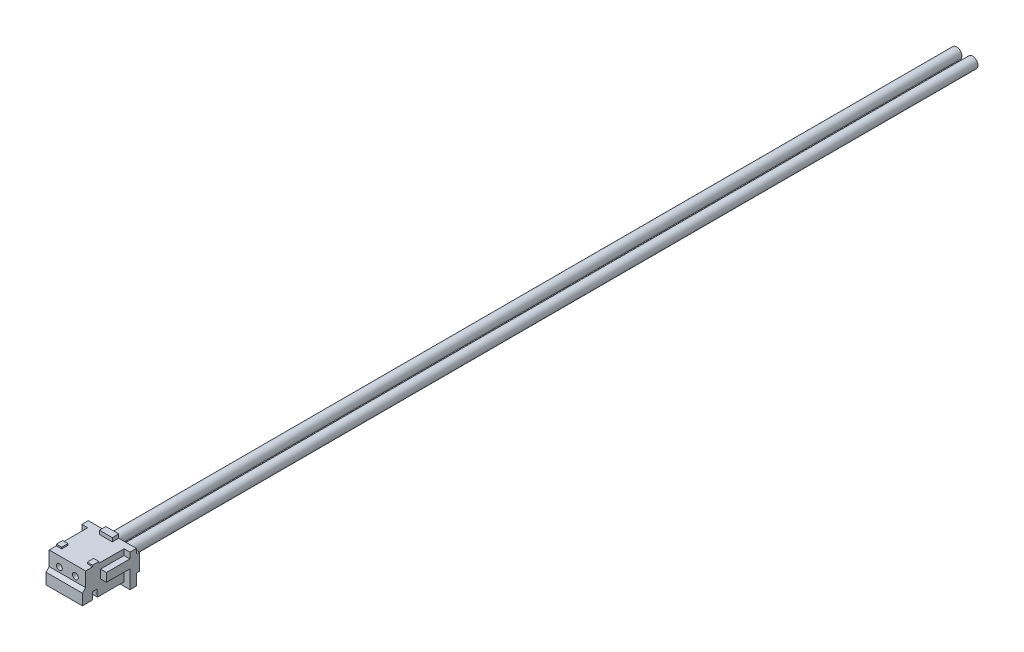
from build123d import *

# Parameters (mm, degrees)
SKETCH1_W                        = 4.5
SKETCH1_H                        = 3.05
BOSS_EXTRUDE1_DEPTH              = 0.6
SKETCH2_W                        = 0.94
SKETCH2_H                        = 1.55
BOSS_EXTRUDE2_DEPTH              = 0.3
SKETCH3_W                        = 0.94
SKETCH3_H                        = 1.55
BOSS_EXTRUDE3_DEPTH              = 0.3
SKETCH4_W                        = 2.62
SKETCH4_H                        = 1.55
CUT_EXTRUDE1_DEPTH               = 0.3
SKETCH5_W                        = 3.4
SKETCH5_H                        = 2.68
BOSS_EXTRUDE4_DEPTH              = 3.9
SKETCH6_W                        = 2.2
SKETCH6_H                        = 0.8
BOSS_EXTRUDE5_DEPTH              = 0.55
SKETCH7_W                        = 2.2
SKETCH7_H                        = 0.8
BOSS_EXTRUDE6_DEPTH              = 0.55
SKETCH8_W                        = 0.3
SKETCH8_H                        = 1.35
CUT_EXTRUDE2_DEPTH               = 6.968877616
CUT_EXTRUDE3_DEPTH               = 6.968877616
SKETCH10_W                       = 0.5
SKETCH10_H                       = 0.59
BOSS_EXTRUDE7_DEPTH              = 0.14
SKETCH11_W                       = 1.2
SKETCH11_H                       = 0.6
BOSS_EXTRUDE8_DEPTH              = 0.35
SKETCH12_W                       = 0.5
SKETCH12_H                       = 0.59
BOSS_EXTRUDE9_DEPTH              = 0.14
DRAFT1_ANGLE                     = 45
F_0_55_0_55_DIAMETER_HOLE1_D     = 0.55
F_0_55_0_55_DIAMETER_HOLE1_DEPTH = 0.4
RIB1_START                       = -0.19
RIB1_OUTLINE_W                   = 1.55
RIB1_OUTLINE_H                   = 0.6
RIB1_DEPTH                       = 0.38
SKETCH16_R                       = 0.5
BOSS_EXTRUDE10_DEPTH             = 80
SKETCH17_W                       = 0.960697218
SKETCH17_H                       = 0.952555717
CUT_EXTRUDE4_DEPTH               = 0.37


# Read off the part's stored shape, not the designer's step: Rib1
with BuildPart() as part:
    # Sketch1 → Boss-Extrude1 (new body)
    with BuildSketch(Plane(origin=(0, 0, -1.65), x_dir=(-1, 0, 0), z_dir=(0, 0, -1))):
        with Locations((0, 1.925)):
            Rectangle(SKETCH1_W, SKETCH1_H)
    extrude(amount=-BOSS_EXTRUDE1_DEPTH)

    # Sketch2 → Boss-Extrude2 (add)
    with BuildSketch(Plane(origin=(0, 0, -1.65), x_dir=(-1, 0, 0), z_dir=(0, 0, -1))):
        with Locations((1.78, 2.225)):
            Rectangle(SKETCH2_W, SKETCH2_H)
    extrude(amount=BOSS_EXTRUDE2_DEPTH)

    # Sketch3 → Boss-Extrude3 (add)
    with BuildSketch(Plane(origin=(0, 0, -1.65), x_dir=(-1, 0, 0), z_dir=(0, 0, -1))):
        with Locations((-1.78, 2.225)):
            Rectangle(SKETCH3_W, SKETCH3_H)
    extrude(amount=BOSS_EXTRUDE3_DEPTH)

    # Sketch4 → Cut-Extrude1 (cut)
    with BuildSketch(Plane(origin=(0, 0, -1.65), x_dir=(-1, 0, 0), z_dir=(0, 0, -1))):
        with Locations((0, 2.225)):
            Rectangle(SKETCH4_W, SKETCH4_H)
    extrude(amount=-CUT_EXTRUDE1_DEPTH, mode=Mode.SUBTRACT)

    # Sketch5 → Boss-Extrude4 (add)
    with BuildSketch(Plane.XY.offset(-1.05)):
        with Locations((0, 2.11)):
            Rectangle(SKETCH5_W, SKETCH5_H)
    extrude(amount=BOSS_EXTRUDE4_DEPTH)

    # Sketch6 → Boss-Extrude5 (add)
    with BuildSketch(Plane(origin=(1.7, 0, 0), x_dir=(0, 0, -1), z_dir=(1, 0, 0))):
        with Locations((-0.05, 2.5)):
            Rectangle(SKETCH6_W, SKETCH6_H)
    extrude(amount=BOSS_EXTRUDE5_DEPTH)

    # Sketch7 → Boss-Extrude6 (add)
    with BuildSketch(Plane.ZY.offset(1.7)):
        with Locations((0.05, 2.5)):
            Rectangle(SKETCH7_W, SKETCH7_H)
    extrude(amount=BOSS_EXTRUDE6_DEPTH)

    # Sketch8 → Cut-Extrude2 (cut, through all)
    with BuildSketch(Plane.ZY.offset(1.7)):
        with Locations((2.7, 2.775)):
            Rectangle(SKETCH8_W, SKETCH8_H)
    extrude(amount=-CUT_EXTRUDE2_DEPTH, mode=Mode.SUBTRACT)

    # Sketch9 → Cut-Extrude3 (cut, through all)
    with BuildSketch(Plane.ZY.offset(1.7)):
        Polygon((1.4411, 0.77), (1.919971259, 0.77), (1.919971259, 1.45), (1.469971259, 1.45), (1.469971259, 1.1), align=None)
    extrude(amount=-CUT_EXTRUDE3_DEPTH, mode=Mode.SUBTRACT)

    # Sketch10 → Boss-Extrude7 (add)
    with BuildSketch(Plane(origin=(0, 3.45, 0), x_dir=(-1, 0, 0), z_dir=(0, 1, 0))):
        with Locations((1.45, 1.595)):
            Rectangle(SKETCH10_W, SKETCH10_H)
    extrude(amount=BOSS_EXTRUDE7_DEPTH)

    # Sketch11 → Boss-Extrude8 (add)
    with BuildSketch(Plane(origin=(0, 3.45, 0), x_dir=(-1, 0, 0), z_dir=(0, 1, 0))):
        with Locations((0, -1.35)):
            Rectangle(SKETCH11_W, SKETCH11_H)
    extrude(amount=BOSS_EXTRUDE8_DEPTH)

    # Sketch12 → Boss-Extrude9 (add)
    with BuildSketch(Plane(origin=(0, 3.45, 0), x_dir=(-1, 0, 0), z_dir=(0, 1, 0))):
        with Locations((-1.45, 1.595)):
            Rectangle(SKETCH12_W, SKETCH12_H)
    extrude(amount=BOSS_EXTRUDE9_DEPTH)

    # Draft1
    draft1_faces = [part.faces().sort_by_distance(p)[0] for p in [
        (0, 2.1, 2.7),
    ]]
    draft(draft1_faces, Plane(origin=(2.250025, 3.45, 2.55), x_dir=(0, 1, 0), z_dir=(0, 0, 1)), DRAFT1_ANGLE)

    # Ø0.55 (0.55) Diameter Hole1
    with Locations(Plane.XY.offset(2.55)):
        with Locations((-0.75, 2.55), (0.75, 2.55)):
            Hole(F_0_55_0_55_DIAMETER_HOLE1_D / 2, depth=F_0_55_0_55_DIAMETER_HOLE1_DEPTH)

    # Rib1 outline → Rib1 (add)
    with BuildSketch(Plane(origin=(0, 0, 0), x_dir=(0, -1, 0), z_dir=(-1, 0, 0)).offset(RIB1_START)):
        with Locations((-2.225, -1.65)):
            Rectangle(RIB1_OUTLINE_W, RIB1_OUTLINE_H)
    extrude(amount=RIB1_DEPTH)

    # Sketch16 → Boss-Extrude10 (add)
    with BuildSketch(Plane(origin=(0, 0, -1.35), x_dir=(-1, 0, 0), z_dir=(0, 0, -1))):
        with Locations(Location((-0.75, 2.216914792, 0), (0, 0, 90))):
            Circle(SKETCH16_R)
        with Locations(Location((0.75, 2.216914792, 0), (0, 0, 90))):
            Circle(SKETCH16_R)
    extrude(amount=BOSS_EXTRUDE10_DEPTH)

    # Sketch17 → Cut-Extrude4 (cut)
    with BuildSketch(Plane.XZ.offset(-0.4)):
        with Locations((0.713949263, -1.321573248)):
            Rectangle(SKETCH17_W, SKETCH17_H)
    extrude(amount=-CUT_EXTRUDE4_DEPTH, mode=Mode.SUBTRACT)


solid = part.part
